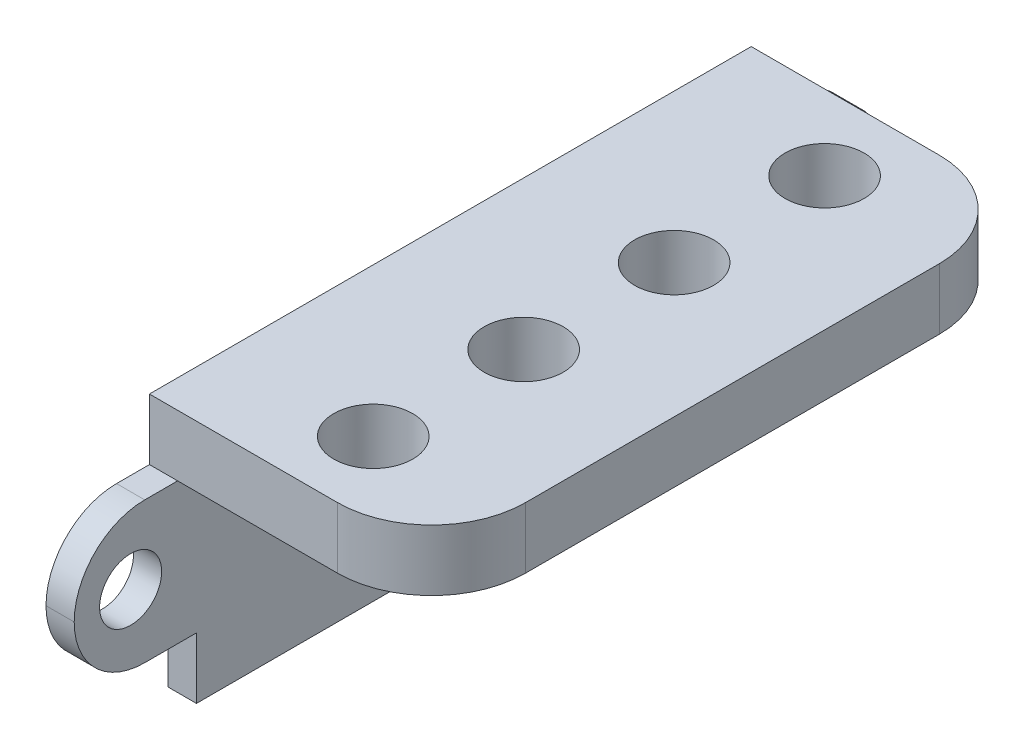
from build123d import *

# Parameters (mm, degrees)
SKETCH_1_W          = 43
SKETCH_1_H          = 7.5
EXTRUDE_1_DEPTH     = 1.5
SKETCH_2_R          = 1.65
CUT_EXTRUDE_2_DEPTH = 11.5
FILLET_1_R          = 3.75
SKETCH_3_W          = 30
SKETCH_3_H          = 14
EXTRUDE_3_DEPTH     = 1.5
SKETCH_4_W          = 15
SKETCH_4_H          = 32
EXTRUDE_4_DEPTH     = 3.25
SKETCH_5_R          = 2.1
CUT_EXTRUDE_3_DEPTH = 13
FILLET_3_R          = 5


with BuildPart() as part:
    # 草圖1 → 填料-伸長1 (new body)
    with BuildSketch(Plane(origin=(0, 0, 0), x_dir=(0, 0, -1), z_dir=(1, 0, 0))):
        Rectangle(SKETCH_1_W, SKETCH_1_H)
    extrude(amount=EXTRUDE_1_DEPTH)

    # 草圖2 → 除料-伸長2 (cut)
    with BuildSketch(Plane(origin=(1.5, 0, 0), x_dir=(0, 0, -1), z_dir=(1, 0, 0))):
        with Locations((-18.5, 0)):
            Circle(SKETCH_2_R)
        with Locations((18.5, 0)):
            Circle(SKETCH_2_R)
    extrude(amount=-CUT_EXTRUDE_2_DEPTH, mode=Mode.SUBTRACT)

    # 圓角1
    fillet_1_edges = [part.edges().sort_by_distance(p)[0] for p in [
        (0.75, -3.75, -21.5),
        (0.75, 3.75, -21.5),
        (0.75, -3.75, 21.5),
        (0.75, 3.75, 21.5),
    ]]
    fillet(fillet_1_edges, radius=FILLET_1_R - 0.0001)  # a hair under: the kernel refuses the full size

    # 草圖3 → 填料-伸長3 (add)
    with BuildSketch(Plane.ZY):
        Rectangle(SKETCH_3_W, SKETCH_3_H)
    extrude(amount=-EXTRUDE_3_DEPTH)

    # 草圖4 → 填料-伸長4 (add)
    with BuildSketch(Plane(origin=(0, 7, 0), x_dir=(1, 0, 0), z_dir=(0, 1, 0))):
        with Locations((7.5, 0)):
            Rectangle(SKETCH_4_W, SKETCH_4_H)
    extrude(amount=-EXTRUDE_4_DEPTH)

    # 草圖5 → 除料-伸長3 (cut)
    with BuildSketch(Plane.XZ.offset(-3.75)):
        with Locations(Location((7.9, 12, 0), (0, 0, 270))):
            Circle(SKETCH_5_R)
        with Locations(Location((7.9, 4, 0), (0, 0, 270))):
            Circle(SKETCH_5_R)
        with Locations(Location((7.9, -4, 0), (0, 0, 270))):
            Circle(SKETCH_5_R)
        with Locations(Location((7.9, -12, 0), (0, 0, 270))):
            Circle(SKETCH_5_R)
    extrude(amount=-CUT_EXTRUDE_3_DEPTH, mode=Mode.SUBTRACT)

    # 圓角3
    fillet_3_edges = [part.edges().sort_by_distance(p)[0] for p in [
        (15, 5.375, -16),
        (15, 5.375, 16),
    ]]
    fillet(fillet_3_edges, radius=FILLET_3_R)


solid = part.part
